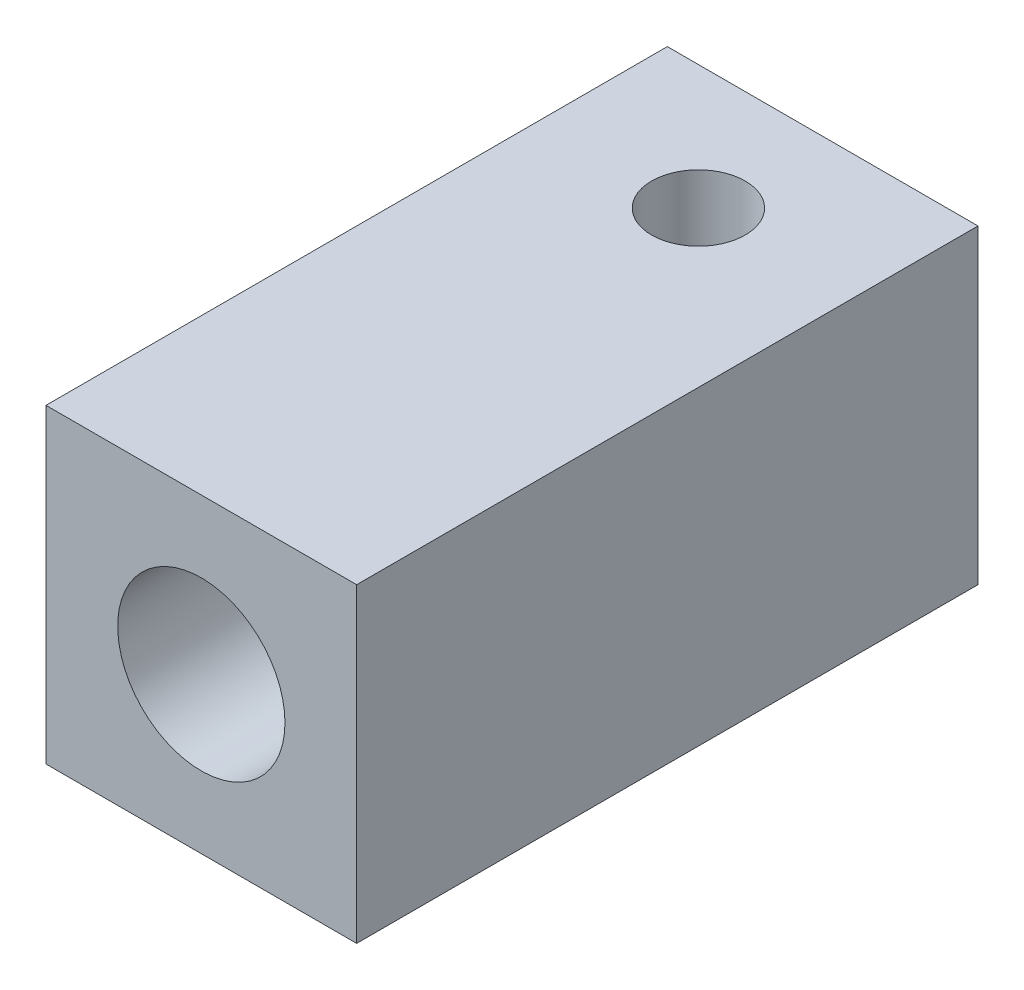
from build123d import *

# Parameters (mm, degrees)
SKETCH1_W                     = 7.5
SKETCH1_H                     = 7.5
BOSS_EXTRUDE1_DEPTH           = 15
HOLE_FOR_TUBING_R             = 1.1
CUT_EXTRUDE1_DEPTH            = 18.839244879
F_10_32_HOLE_FOR_LUER_SCREW_R = 2.0193
CUT_EXTRUDE2_DEPTH            = 7.5
F_4_40_SET_SCREW_HOLE_R       = 1.1303
CUT_EXTRUDE3_DEPTH            = 2


with BuildPart() as part:
    # Sketch1 → Boss-Extrude1 (new body)
    with BuildSketch(Plane.XY):
        with Locations((-4.663043478, 0.989130435)):
            Rectangle(SKETCH1_W, SKETCH1_H)
    extrude(amount=BOSS_EXTRUDE1_DEPTH)

    # hole for tubing → Cut-Extrude1 (cut, through all)
    with BuildSketch(Plane(origin=(0, 0, 0), x_dir=(-1, 0, 0), z_dir=(0, 0, -1))):
        with Locations((4.663043478, 0.989130435)):
            Circle(HOLE_FOR_TUBING_R)
    extrude(amount=-CUT_EXTRUDE1_DEPTH, mode=Mode.SUBTRACT)

    # 10-32 hole for luer screw → Cut-Extrude2 (cut)
    with BuildSketch(Plane.XY.offset(15)):
        with Locations((-4.663043478, 0.989130435)):
            Circle(F_10_32_HOLE_FOR_LUER_SCREW_R)
    extrude(amount=-CUT_EXTRUDE2_DEPTH, mode=Mode.SUBTRACT)

    # 4-40 set screw hole → Cut-Extrude3 (cut)
    with BuildSketch(Plane(origin=(0, 4.739130435, 0), x_dir=(1, 0, 0), z_dir=(0, 1, 0))):
        with Locations((-4.663043478, -3)):
            Circle(F_4_40_SET_SCREW_HOLE_R)
    extrude(amount=-CUT_EXTRUDE3_DEPTH, mode=Mode.SUBTRACT)


solid = part.part
